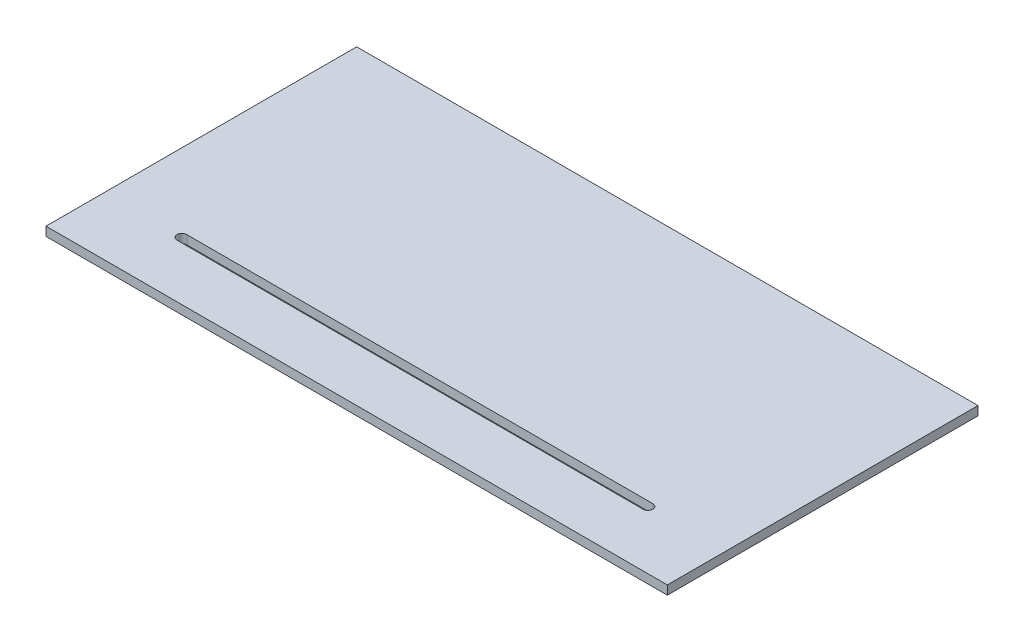
from build123d import *

# Parameters (mm, degrees)
SKETCH1_W           = 1219.2
SKETCH1_H           = 609.6
BOSS_EXTRUDE1_DEPTH = 17.4752
CUT_EXTRUDE1_DEPTH  = 682.777516947


with BuildPart() as part:
    # Sketch1 → Boss-Extrude1 (new body)
    with BuildSketch(Plane(origin=(0, 0, 0), x_dir=(1, 0, 0), z_dir=(0, 1, 0))):
        Rectangle(SKETCH1_W, SKETCH1_H)
    extrude(amount=BOSS_EXTRUDE1_DEPTH)

    # Sketch2 → Cut-Extrude1 (cut, through all)
    with BuildSketch(Plane(origin=(0, 17.4752, 0), x_dir=(1, 0, 0), z_dir=(0, 1, 0))):
        with BuildLine():
            Line((-457.2, -180.975), (457.2, -180.975))
            ThreePointArc((457.2, -180.975), (466.725, -190.5), (457.2, -200.025))
            Line((457.2, -200.025), (-457.2, -200.025))
            ThreePointArc((-457.2, -200.025), (-466.725, -190.5), (-457.2, -180.975))
        make_face()
    extrude(amount=-CUT_EXTRUDE1_DEPTH, mode=Mode.SUBTRACT)


solid = part.part
